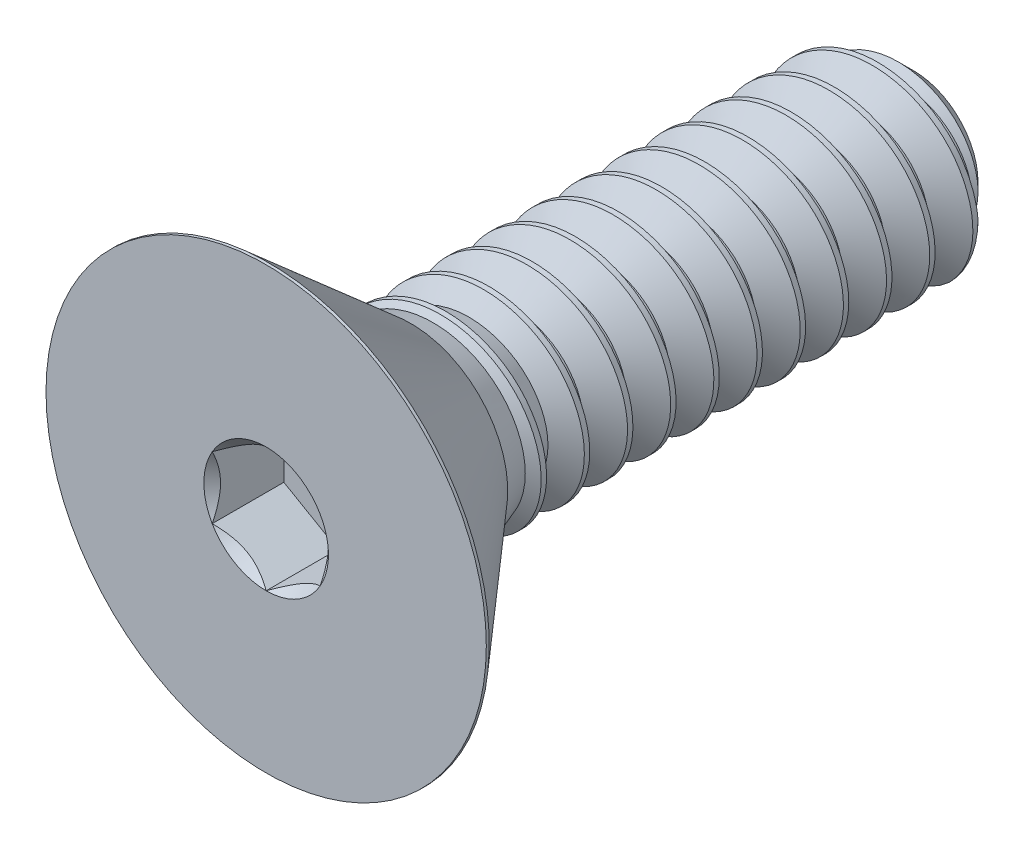
from build123d import *

# Parameters (mm, degrees)
CUT_EXTRUDE1_DEPTH = 1.0541
CUT_SWEEP1_PITCH   = 0.635


with BuildPart() as part:
    # Sketch2 → Revolve1 (revolve)
    with BuildSketch(Plane(origin=(0, 0, 0), x_dir=(0, 0, -1), z_dir=(1, 0, 0)), mode=Mode.PRIVATE) as revolve1_sk:
        Polygon((-4.720336, 3.2385), (-2.631151936, 1.4224), (4.28625, 1.4224), (4.7625, 0.94615), (4.7625, 0), (-4.7625, 0), (-4.7625, 3.2385), align=None)
    revolve(revolve1_sk.sketch.rotate(Axis((0, 0, -4.7625), (0, 0, 1)), 90), axis=Axis((0, 0, -4.7625), (0, 0, 1)))

    # Cut-Extrude2 cone 1 section (through the dimple's axis) → Cut-Extrude2 (revolve, cut)
    with BuildSketch(Plane(origin=(0, 0, 4.7625), x_dir=(0, -1, 0), z_dir=(1, 0, 0))):
        Polygon((0, 0), (0.916543552, 0), (0, 0.916543552), align=None)
    revolve(axis=Axis((0, 0, 4.7625), (0, 0, -1)), mode=Mode.SUBTRACT)

    # Sketch9 → Cut-Extrude1 (cut)
    with BuildSketch(Plane.XY.offset(4.7625)):
        Polygon((0.79375, -0.458271776), (0.79375, 0.458271776), (0, 0.916543552), (-0.79375, 0.458271776), (-0.79375, -0.458271776), (0, -0.916543552), align=None)
    extrude(amount=-CUT_EXTRUDE1_DEPTH, mode=Mode.SUBTRACT)


with BuildPart() as body_2:
    # Split1: the piece on the far side of the plane
    add(part.part)
    split(bisect_by=Plane.XY.offset(2.631151936), keep=Keep.BOTTOM)

    # Cut-Sweep1: the profile of Sketch4 screwed along a right-hand helix of 15 turns, 6 arcs to a turn; built about Z, then put on its axis
    cut_sweep1_z = Axis((0, 0, 0), (0, 0, 1))
    cut_sweep1_corners = [(1.456770383, 0, 0.01984375), (1.456770383, 0, -0.57546875), (1.009955401, 0, -0.3175), (1.009955401, 0, -0.238125)]
    with BuildLine(mode=Mode.PRIVATE) as cut_sweep1_profile:
        Line(cut_sweep1_corners[0], cut_sweep1_corners[1])
        Line(cut_sweep1_corners[1], cut_sweep1_corners[2])
        Line(cut_sweep1_corners[2], cut_sweep1_corners[3])
        Line(cut_sweep1_corners[3], cut_sweep1_corners[0])
    cut_sweep1_cap = Face(cut_sweep1_profile.wire())
    cut_sweep1_turn_angles = [0, 30, 60, 90, 120, 150, 180, 210, 240, 270, 300, 330, 360]
    cut_sweep1_turn_weights = [1, 0.8660254037844387, 1, 0.8660254037844387, 1, 0.8660254037844387, 1, 0.8660254037844387, 1, 0.8660254037844387, 1, 0.8660254037844387, 1]
    cut_sweep1_turn_rails = [Edge.make_bspline([Vector(p[0], p[1], 0).rotate(cut_sweep1_z, cut_sweep1_turn_angles[k]) / cut_sweep1_turn_weights[k] + Vector(0, 0, p[2] + CUT_SWEEP1_PITCH * cut_sweep1_turn_angles[k] / 360) for k in range(13)], [0, 0, 0, 1, 1, 2, 2, 3, 3, 4, 4, 5, 5, 6, 6, 6], 2, cut_sweep1_turn_weights) for p in cut_sweep1_corners]
    cut_sweep1_turn_sides = [Face.make_surface_from_curves(cut_sweep1_turn_rails[p[0]], cut_sweep1_turn_rails[p[1]]) for p in [(0, 1), (1, 2), (2, 3), (3, 0)]]
    cut_sweep1_turn = Solid(Shell([*cut_sweep1_turn_sides, cut_sweep1_cap, cut_sweep1_cap.rotate(cut_sweep1_z, 360).moved(Location((0, 0, CUT_SWEEP1_PITCH * 360 / 360)))]))
    cut_sweep1_each = [*[cut_sweep1_turn.moved(Location((0, 0, CUT_SWEEP1_PITCH * i))) for i in range(15)]]
    add(Plane(origin=(0, 0, -4.7625), x_dir=(0, 1, 0), z_dir=(0, 0, 1)) * Compound([cut_sweep1_each[i] for i in range(0, 15, 2)]), mode=Mode.SUBTRACT)
    add(Plane(origin=(0, 0, -4.7625), x_dir=(0, 1, 0), z_dir=(0, 0, 1)) * Compound([cut_sweep1_each[i] for i in range(1, 15, 2)]), mode=Mode.SUBTRACT)


with BuildPart() as part_1:
    add(part.part)

    # Split1
    split(bisect_by=Plane.XY.offset(2.631151936), keep=Keep.TOP)

    add(body_2.part)  # Boss-Extrude2 merges body 2
    # Boss-Extrude2 cone 1 section (through the dimple's axis) → Boss-Extrude2 (revolve)
    with BuildSketch(Plane(origin=(0, 0, 2.631151936), x_dir=(0, -1, 0), z_dir=(1, 0, 0))):
        Polygon((0, 0), (1.4224, 0), (0, 3.908011881), align=None)
    revolve(axis=Axis((0, 0, 2.631151936), (0, 0, -1)))


solid = part_1.part
